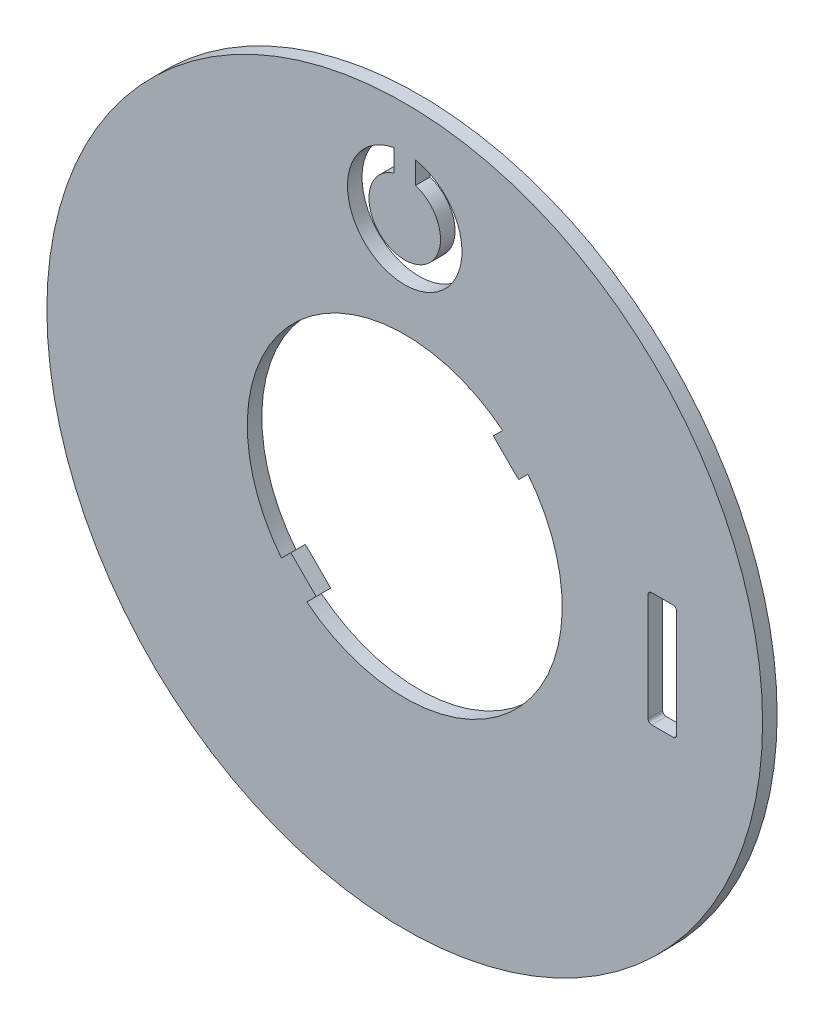
from build123d import *

# Parameters (mm, degrees)
SKETCH1_R           = 25
BOSS_EXTRUDE1_DEPTH = 1.016
CUT_EXTRUDE1_DEPTH  = 107.673671804


with BuildPart() as part:
    # Sketch1 → Boss-Extrude1 (new body)
    with BuildSketch(Plane.XY):
        with Locations((37.000000001, 61.8)):
            Circle(SKETCH1_R)
        with BuildLine():
            ThreePointArc((45.611674235, 68.643907282), (44.778174594, 54.021825407), (30.156092719, 53.188325765))
            Line((30.156092719, 53.188325765), (30.812815665, 53.845048712))
            Line((30.812815665, 53.845048712), (29.045048712, 55.612815665))
            Line((29.045048712, 55.612815665), (28.388325766, 54.956092718))
            ThreePointArc((28.388325766, 54.956092718), (29.221825408, 69.578174593), (43.843907282, 70.411674235))
            Line((43.843907282, 70.411674235), (43.187184336, 69.754951288))
            Line((43.187184336, 69.754951288), (44.954951289, 67.987184335))
            Line((44.954951289, 67.987184335), (45.611674235, 68.643907282))
        make_face(mode=Mode.SUBTRACT)
    extrude(amount=BOSS_EXTRUDE1_DEPTH)

    # Sketch2 → Cut-Extrude1 (cut, through all)
    with BuildSketch(Plane.XY):
        with BuildLine():
            ThreePointArc((37.750000001, 82.184848004), (37.000000001, 77.3), (36.250000001, 82.184848004))
            Line((36.250000001, 82.184848004), (36.250000001, 83.729058411))
            ThreePointArc((36.250000001, 83.729058411), (37.000000001, 75.8), (37.750000001, 83.729058411))
            Line((37.750000001, 83.729058411), (37.750000001, 82.184848004))
        make_face()
        with BuildLine():
            ThreePointArc((54.000000001, 58.05), (54.073223305, 57.873223305), (54.250000001, 57.8))
            Line((54.250000001, 57.8), (55.750000001, 57.8))
            ThreePointArc((55.750000001, 57.8), (55.926776696, 57.873223305), (56.000000001, 58.05))
            Line((56.000000001, 58.05), (56.000000001, 65.55))
            ThreePointArc((56.000000001, 65.55), (55.926776696, 65.726776695), (55.750000001, 65.8))
            Line((55.750000001, 65.8), (54.250000001, 65.8))
            ThreePointArc((54.250000001, 65.8), (54.073223305, 65.726776695), (54.000000001, 65.55))
            Line((54.000000001, 65.55), (54.000000001, 58.05))
        make_face()
    extrude(amount=CUT_EXTRUDE1_DEPTH, mode=Mode.SUBTRACT)


solid = part.part
